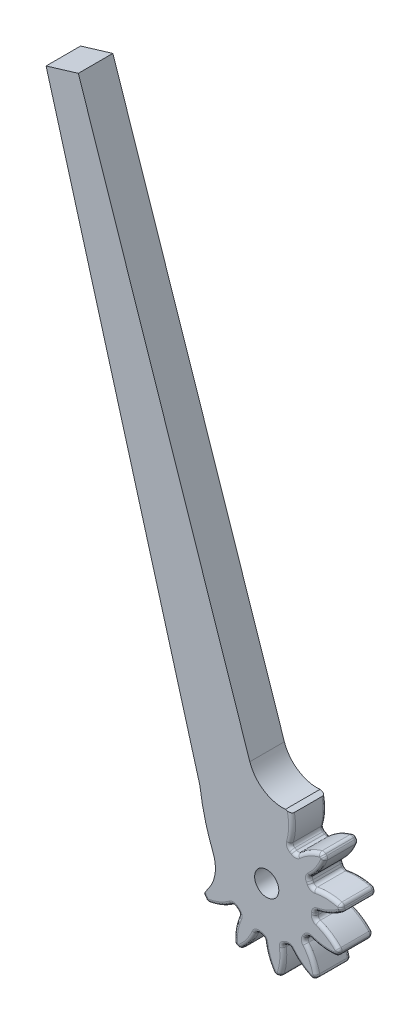
from build123d import *

# Parameters (mm, degrees)
SKETCH1_R           = 1.75
BOSS_EXTRUDE1_DEPTH = 5
BOSS_EXTRUDE2_DEPTH = 5
FILLET3_DEPTH       = 5
FILLET4_R           = 0.5


with BuildPart() as part:
    # Sketch1 → Boss-Extrude1 (new body)
    with BuildSketch(Plane.XY):
        with BuildLine():
            Line((-31.946658289, 86.542269644), (-27.28132686, 87.94879112))
            Line((-27.28132686, 87.94879112), (-1.948886352, 12.575189105))
            add(Edge.make_bspline(
                [(1.981710918, 6.713629558), (-0.316538814, 8.421920522), (-1.948886352, 12.575189105)],
                knots=[0, 0, 0, 1, 1, 1], degree=2))
            ThreePointArc((1.981710918, 6.713629558), (5.460456275, -4.379887815), (-6.123611532, -3.391368721))
            add(Edge.make_bspline(
                [(-6.123611532, -3.391368721), (-8.855583685, 1.343219478), (-9.677848837, 7.452443472)],
                knots=[0, 0, 0, 1, 1, 1], degree=2))
            Line((-9.677848837, 7.452443472), (-31.946658289, 86.542269644))
        make_face()
        Circle(SKETCH1_R, mode=Mode.SUBTRACT)
    extrude(amount=BOSS_EXTRUDE1_DEPTH)

    # Sketch5 → Boss-Extrude2 (add)
    with BuildSketch(Plane.XY.offset(5)):
        with BuildLine():
            Line((1.840160138, 6.234084589), (0.708623564, 7.152437709))
            add(Edge.make_bspline(
                [(2.712142885, 10.660407167), (1.244868806, 9.179850806), (0.708623564, 7.152437709)],
                knots=[0, 0, 0, 1, 1, 1], degree=2))
            ThreePointArc((2.712142885, 10.660407167), (3.114117157, 10.549989305), (3.511619057, 10.424419965))
            add(Edge.make_bspline(
                [(3.511619057, 10.424419965), (3.797005345, 9.064405527), (3.719796973, 7.665323824), (3.245926225, 6.261298492), (3.169397871, 6.044589279), (3.106470995, 5.881953933), (3.047849529, 5.741133447)],
                knots=[0, 0, 0, 0, 1, 1.040555751, 1.056879332, 1.163235812, 1.163235812, 1.163235812, 1.163235812], degree=3))
            ThreePointArc((3.047849529, 5.741133447), (2.456401806, 6.017980572), (1.840160138, 6.234084589))
        make_face()
        with BuildLine():
            ThreePointArc((8.396761737, 7.105940636), (8.121488777, 7.4189905), (7.834552056, 7.721385503))
            add(Edge.make_bspline(
                [(7.834552056, 7.721385503), (6.486874717, 7.382489658), (5.262833429, 6.700497231), (4.208023409, 5.659720386), (4.046698082, 5.496032847), (3.92803263, 5.3682496), (3.827094766, 5.253888622)],
                knots=[0, 0, 0, 0, 1, 1.040555751, 1.056879332, 1.163235812, 1.163235812, 1.163235812, 1.163235812], degree=3))
            ThreePointArc((3.827094766, 5.253888622), (4.79906155, 4.383948932), (5.577757973, 3.337456516))
            add(Edge.make_bspline(
                [(8.396761737, 7.105940636), (7.937654631, 5.794336554), (7.148005274, 4.636819972), (6.016303616, 3.680215573), (5.838728193, 3.534316838), (5.700759589, 3.427664543), (5.577757973, 3.337456516)],
                knots=[0, 0, 0, 0, 1, 1.040555751, 1.056879332, 1.163235812, 1.163235812, 1.163235812, 1.163235812], degree=3))
        make_face()
        with BuildLine():
            ThreePointArc((10.86162986, 1.739251787), (10.787930254, 2.149548982), (10.698737449, 2.556759079))
            add(Edge.make_bspline(
                [(10.698737449, 2.556759079), (9.370018715, 2.963687977), (7.969677144, 3.013025898), (6.528623458, 2.667765283), (6.305893374, 2.611101525), (6.1382438, 2.563104986), (5.992708565, 2.517428063)],
                knots=[0, 0, 0, 0, 1, 1.040555751, 1.056879332, 1.163235812, 1.163235812, 1.163235812, 1.163235812], degree=3))
            ThreePointArc((5.992708565, 2.517428063), (6.374686059, 1.270188035), (6.499938803, -0.028205682))
            add(Edge.make_bspline(
                [(10.86162986, 1.739251787), (9.790361953, 0.854113564), (8.515879383, 0.271803574), (7.052547417, 0.038350843), (6.825109095, 0.005316298), (6.651866701, -0.01461159), (6.499938803, -0.028205682)],
                knots=[0, 0, 0, 0, 1, 1.040555751, 1.056879332, 1.163235812, 1.163235812, 1.163235812, 1.163235812], degree=3))
        make_face()
        with BuildLine():
            ThreePointArc((10.195752199, -4.128757331), (10.344869051, -3.739476476), (10.479129011, -3.344825132))
            add(Edge.make_bspline(
                [(10.479129011, -3.344825132), (9.552357496, -2.309364286), (8.379348756, -1.542917133), (6.967419336, -1.093143929), (6.747484002, -1.026451199), (6.579173457, -0.980826554), (6.430989789, -0.944653549)],
                knots=[0, 0, 0, 0, 1, 1.040555751, 1.056879332, 1.163235812, 1.163235812, 1.163235812, 1.163235812], degree=3))
            ThreePointArc((6.430989789, -0.944653549), (6.112877167, -2.209690645), (5.5485835, -3.385737902))
            add(Edge.make_bspline(
                [(10.195752199, -4.128757331), (8.821104725, -4.332298301), (7.429144578, -4.171557225), (6.055971708, -3.614568097), (5.844227091, -3.525216607), (5.685646129, -3.452676093), (5.5485835, -3.385737902)],
                knots=[0, 0, 0, 0, 1, 1.040555751, 1.056879332, 1.163235812, 1.163235812, 1.163235812, 1.163235812], degree=3))
        make_face()
        with BuildLine():
            ThreePointArc((6.591060693, -8.806697391), (6.920012705, -8.550638816), (7.239026467, -8.282300152))
            add(Edge.make_bspline(
                [(7.239026467, -8.282300152), (6.981333906, -6.916767601), (6.37376491, -5.654131208), (5.397932941, -4.538966383), (5.244186306, -4.368140612), (5.123728462, -4.242045587), (5.015608678, -4.134449127)],
                knots=[0, 0, 0, 0, 1, 1.040555751, 1.056879332, 1.163235812, 1.163235812, 1.163235812, 1.163235812], degree=3))
            ThreePointArc((5.015608678, -4.134449127), (4.089098416, -5.05265021), (2.997909806, -5.767368273))
            add(Edge.make_bspline(
                [(6.591060693, -8.806697391), (5.309260724, -8.269972655), (4.201040258, -7.412512367), (3.313828517, -6.225627392), (3.17881067, -6.039644455), (3.080600365, -5.895544547), (2.997909806, -5.767368273)],
                knots=[0, 0, 0, 0, 1, 1.040555751, 1.056879332, 1.163235812, 1.163235812, 1.163235812, 1.163235812], degree=3))
        make_face()
        with BuildLine():
            ThreePointArc((1.086568168, -10.946203434), (1.500538526, -10.897173217), (1.91235387, -10.832492911))
            add(Edge.make_bspline(
                [(1.91235387, -10.832492911), (2.398017319, -9.530488449), (2.531013174, -8.135603921), (2.272551527, -6.676481515), (2.229309374, -6.450761361), (2.191424883, -6.280541465), (2.154533327, -6.13253505)],
                knots=[0, 0, 0, 0, 1, 1.040555751, 1.056879332, 1.163235812, 1.163235812, 1.163235812, 1.163235812], degree=3))
            ThreePointArc((2.154533327, -6.13253505), (0.886681856, -6.439238719), (-0.416878538, -6.486617939))
            add(Edge.make_bspline(
                [(1.086568168, -10.946203434), (0.267080498, -9.823918014), (-0.23796788, -8.516892047), (-0.383489431, -7.042217812), (-0.402863093, -6.813210972), (-0.412394698, -6.639086889), (-0.416878538, -6.486617939)],
                knots=[0, 0, 0, 0, 1, 1.040555751, 1.056879332, 1.163235812, 1.163235812, 1.163235812, 1.163235812], degree=3))
        make_face()
        with BuildLine():
            ThreePointArc((-4.731115725, -9.930586287), (-4.351449439, -10.102716851), (-3.965533774, -10.260338293))
            add(Edge.make_bspline(
                [(-3.965533774, -10.260338293), (-2.876501482, -9.397150439), (-2.041275375, -8.272077955), (-1.507867962, -6.889574012), (-1.428141556, -6.674020836), (-1.372532904, -6.508740089), (-1.327562645, -6.362984946)],
                knots=[0, 0, 0, 0, 1, 1.040555751, 1.056879332, 1.163235812, 1.163235812, 1.163235812, 1.163235812], degree=3))
            ThreePointArc((-1.327562645, -6.362984946), (-2.571311032, -5.96978723), (-3.711506212, -5.336171065))
            add(Edge.make_bspline(
                [(-4.731115725, -9.930586287), (-4.852082754, -8.546226658), (-4.608384385, -7.166370923), (-3.970270753, -5.828966118), (-3.868415984, -5.622944086), (-3.786521507, -5.468985188), (-3.711506212, -5.336171065)],
                knots=[0, 0, 0, 0, 1, 1.040555751, 1.056879332, 1.163235812, 1.163235812, 1.163235812, 1.163235812], degree=3))
        make_face()
        with BuildLine():
            ThreePointArc((-9.185107354, -6.052586463), (-8.949179788, -6.39626306), (-8.700399763, -6.730753596))
            add(Edge.make_bspline(
                [(-8.700399763, -6.730753596), (-7.321900252, -6.555186789), (-6.025188665, -6.024216165), (-4.853661035, -5.116822297), (-4.673946332, -4.973566939), (-4.540873122, -4.860865705), (-4.427003233, -4.759374158)],
                knots=[0, 0, 0, 0, 1, 1.040555751, 1.056879332, 1.163235812, 1.163235812, 1.163235812, 1.163235812], degree=3))
            ThreePointArc((-4.427003233, -4.759374158), (-5.288151693, -3.77960999), (-5.936332892, -2.647631357))
            add(Edge.make_bspline(
                [(-9.185107354, -6.052586463), (-8.572686323, -4.805179118), (-7.65048459, -3.750221911), (-6.412665037, -2.935578815), (-6.218940358, -2.811925184), (-6.069224986, -2.722508436), (-5.936332892, -2.647631357)],
                knots=[0, 0, 0, 0, 1, 1.040555751, 1.056879332, 1.163235812, 1.163235812, 1.163235812, 1.163235812], degree=3))
        make_face()
    extrude(amount=-BOSS_EXTRUDE2_DEPTH)

    # Fillet3: read off the stored shape, not the designer's step
    # Fillet3 outline → Fillet3 (add)
    with BuildSketch(Plane.XY):
        with BuildLine():
            ThreePointArc((-7.781513306, 0.039474635), (-7.47044358, -2.466199415), (-8.423358909, -4.804386574))
            add(Edge.make_bspline(
                [(-6.388750999, -2.920453485), (-6.435031069, -2.950299311), (-7.233177208, -3.475972412), (-7.904067996, -4.110186675), (-8.423358909, -4.804386574)],
                knots=[0.124066816, 0.124066816, 0.124066816, 0.124066816, 0.163235812, 0.805763717, 0.805763717, 0.805763717, 0.805763717], degree=3))
            add(Edge.make_bspline(
                [(-7.781513306, 0.039474635), (-7.168598966, -1.500570091), (-6.388750999, -2.920453485)],
                knots=[0.654965302, 0.654965302, 0.654965302, 0.95062256, 0.95062256, 0.95062256], degree=2))
        make_face()
        with BuildLine():
            ThreePointArc((2.712142885, 10.660407167), (-0.451531466, 11.464795821), (-2.44458079, 14.050067741))
            Line((-2.44458079, 14.050067741), (-1.948886352, 12.575189105))
            add(Edge.make_bspline(
                [(0.879047788, 7.715320835), (-0.722771888, 9.45552092), (-1.948886352, 12.575189105)],
                knots=[0.248864329, 0.248864329, 0.248864329, 1, 1, 1], degree=2))
            add(Edge.make_bspline(
                [(2.712142885, 10.660407167), (1.452516125, 9.389377822), (0.879047788, 7.715320835)],
                knots=[0, 0, 0, 0.858480892, 0.858480892, 0.858480892], degree=2))
        make_face()
    extrude(amount=FILLET3_DEPTH)

    # Fillet4
    fillet4_edges = [part.edges().sort_by_distance(p)[0] for p in [
        (-4.628516319, -7.801338585, 0),
        (-4.628516319, -7.801338585, 5),
        (-6.641421741, -6.178637737, 5),
        (-6.641421741, -6.178637737, 0),
        (-2.488834464, -8.722943886, 5),
        (-2.488834464, -8.722943886, 0),
        (0.073190147, -9.070760179, 0),
        (0.073190147, -9.070760179, 5),
        (4.753800355, -7.725634551, 0),
        (4.753800355, -7.725634551, 5),
        (2.381132074, -8.752957047, 5),
        (2.381132074, -8.752957047, 0),
        (8.064179703, -4.153679421, 0),
        (8.064179703, -4.153679421, 5),
        (6.564763385, -6.260026256, 5),
        (6.564763385, -6.260026256, 0),
        (9.050147621, 0.615528284, 0),
        (9.050147621, 0.615528284, 5),
        (8.856173588, -1.962711494, 5),
        (8.856173588, -1.962711494, 0),
        (7.427509659, 5.207316707, 0),
        (7.427509659, 5.207316707, 5),
        (8.594888801, 2.900333348, 5),
        (8.594888801, 2.900333348, 0),
        (3.66397343, 8.298153152, 0),
        (3.66397343, 8.298153152, 5),
        (5.856221501, 6.927388884, 5),
        (5.856221501, 6.927388884, 0),
        (-8.700399763, -6.730753596, 2.5),
        (-8.949179788, -6.39626306, 5),
        (-8.949179788, -6.39626306, 0),
        (-9.185107354, -6.052586463, 2.5),
        (-3.965533774, -10.260338293, 2.5),
        (-4.351449439, -10.102716851, 5),
        (-4.351449439, -10.102716851, 0),
        (-4.731115725, -9.930586287, 2.5),
        (-3.946677398, -5.781326623, 2.5),
        (-4.393266434, -5.449698161, 0),
        (-4.393266434, -5.449698161, 5),
        (-4.812113409, -5.083656612, 2.5),
        (1.91235387, -10.832492911, 2.5),
        (1.500538526, -10.897173217, 5),
        (1.500538526, -10.897173217, 0),
        (1.086568168, -10.946203434, 2.5),
        (-1.48946058, -6.839700811, 2.5),
        (-0.941670579, -6.936372, 0),
        (-0.941670579, -6.936372, 5),
        (-0.387934231, -6.989242236, 2.5),
        (3.282626726, -6.182585364, 2.5),
        (2.781351502, -6.42371262, 0),
        (2.781351502, -6.42371262, 5),
        (2.26251294, -6.624276202, 2.5),
        (7.239026467, -8.282300152, 2.5),
        (6.920012705, -8.550638816, 5),
        (6.920012705, -8.550638816, 0),
        (6.591060693, -8.806697391, 2.5),
        (6.007006501, -3.59386601, 2.5),
        (5.70267949, -4.059488469, 0),
        (5.70267949, -4.059488469, 5),
        (5.362341897, -4.499476567, 2.5),
        (10.479129011, -3.344825132, 2.5),
        (10.344869051, -3.739476476, 5),
        (10.344869051, -3.739476476, 0),
        (10.195752199, -4.128757331, 2.5),
        (6.999932478, 0.030745839, 2.5),
        (6.980272606, -0.525161252, 0),
        (6.980272606, -0.525161252, 5),
        (6.916534564, -1.077752118, 2.5),
        (10.698737449, 2.556759079, 2.5),
        (10.787930254, 2.149548982, 5),
        (10.787930254, 2.149548982, 0),
        (10.86162986, 1.739251787, 2.5),
        (5.975204624, 3.646495537, 2.5),
        (6.245878635, 3.160537942, 0),
        (6.245878635, 3.160537942, 5),
        (6.477111935, 2.654622569, 2.5),
        (3.228189514, 6.211182855, 2.5),
        (3.711178589, 5.935246707, 0),
        (3.711178589, 5.935246707, 5),
        (4.170732768, 5.62183139, 2.5),
        (7.834552056, 7.721385503, 2.5),
        (8.121488777, 7.4189905, 5),
        (8.121488777, 7.4189905, 0),
        (8.396761737, 7.105940636, 2.5),
    ]]
    fillet(fillet4_edges, radius=FILLET4_R)


solid = part.part
